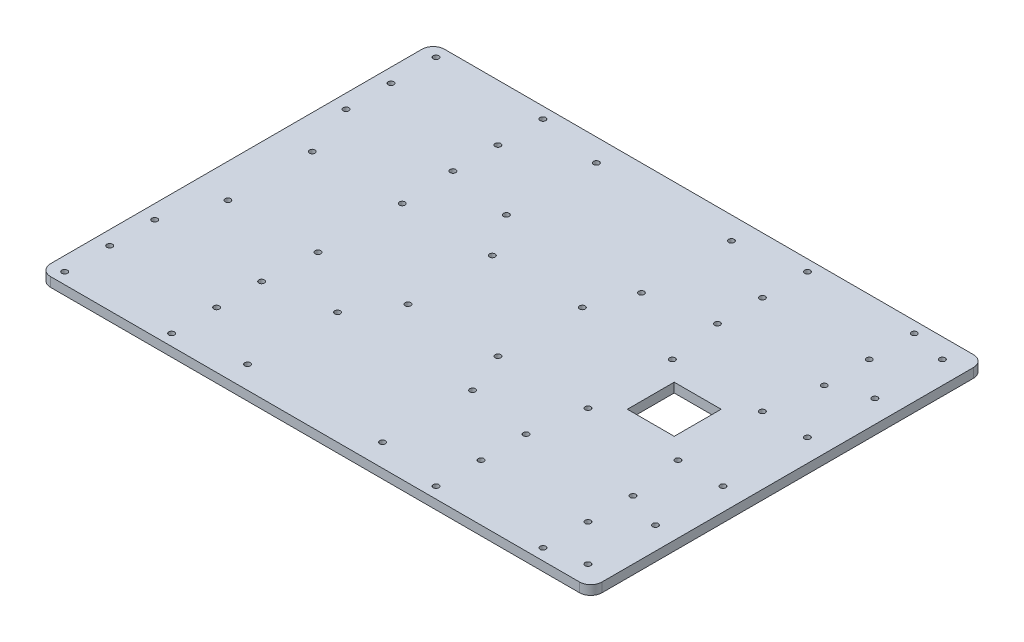
from build123d import *

# Parameters (mm, degrees)
SKETCH1_R           = 1.5
SKETCH1_W           = 25
SKETCH1_H           = 25
BOSS_EXTRUDE1_DEPTH = 5


with BuildPart() as part:
    # Sketch1 → Boss-Extrude1 (new body)
    with BuildSketch(Plane(origin=(0, 0, 0), x_dir=(1, 0, 0), z_dir=(0, 1, 0))):
        with BuildLine():
            Line((-129, -105), (129, -105))
            Line((129, -105), (153, -105))
            ThreePointArc((153, -105), (157.242640687, -103.242640687), (159, -99))
            Line((159, -99), (159, 99))
            ThreePointArc((159, 99), (157.242640687, 103.242640687), (153, 105))
            Line((153, 105), (129, 105))
            Line((129, 105), (-129, 105))
            ThreePointArc((-129, 105), (-133.242640687, 103.242640687), (-135, 99))
            Line((-135, 99), (-135, -99))
            ThreePointArc((-135, -99), (-133.242640687, -103.242640687), (-129, -105))
        make_face()
        with Locations((-127.5, 99)):
            Circle(SKETCH1_R, mode=Mode.SUBTRACT)
        with Locations((-127.5, 75)):
            Circle(SKETCH1_R, mode=Mode.SUBTRACT)
        with Locations((-127.5, 51)):
            Circle(SKETCH1_R, mode=Mode.SUBTRACT)
        with Locations((-70.5, 99)):
            Circle(SKETCH1_R, mode=Mode.SUBTRACT)
        with Locations((-70.5, 75)):
            Circle(SKETCH1_R, mode=Mode.SUBTRACT)
        with Locations((-70.5, 51)):
            Circle(SKETCH1_R, mode=Mode.SUBTRACT)
        with Locations((70.5, 51)):
            Circle(SKETCH1_R, mode=Mode.SUBTRACT)
        with Locations((70.5, 75)):
            Circle(SKETCH1_R, mode=Mode.SUBTRACT)
        with Locations((70.5, 99)):
            Circle(SKETCH1_R, mode=Mode.SUBTRACT)
        with Locations((127.5, 51)):
            Circle(SKETCH1_R, mode=Mode.SUBTRACT)
        with Locations((127.5, 75)):
            Circle(SKETCH1_R, mode=Mode.SUBTRACT)
        with Locations((127.5, 99)):
            Circle(SKETCH1_R, mode=Mode.SUBTRACT)
        with Locations((127.5, -99)):
            Circle(SKETCH1_R, mode=Mode.SUBTRACT)
        with Locations((127.5, -75)):
            Circle(SKETCH1_R, mode=Mode.SUBTRACT)
        with Locations((127.5, -51)):
            Circle(SKETCH1_R, mode=Mode.SUBTRACT)
        with Locations((70.5, -99)):
            Circle(SKETCH1_R, mode=Mode.SUBTRACT)
        with Locations((70.5, -75)):
            Circle(SKETCH1_R, mode=Mode.SUBTRACT)
        with Locations((70.5, -51)):
            Circle(SKETCH1_R, mode=Mode.SUBTRACT)
        with Locations((-70.5, -51)):
            Circle(SKETCH1_R, mode=Mode.SUBTRACT)
        with Locations((-70.5, -75)):
            Circle(SKETCH1_R, mode=Mode.SUBTRACT)
        with Locations((-70.5, -99)):
            Circle(SKETCH1_R, mode=Mode.SUBTRACT)
        with Locations((-127.5, -51)):
            Circle(SKETCH1_R, mode=Mode.SUBTRACT)
        with Locations((-127.5, -75)):
            Circle(SKETCH1_R, mode=Mode.SUBTRACT)
        with Locations((-127.5, -99)):
            Circle(SKETCH1_R, mode=Mode.SUBTRACT)
        with Locations((147, -94.5)):
            Circle(SKETCH1_R, mode=Mode.SUBTRACT)
        with Locations((147, -58.5)):
            Circle(SKETCH1_R, mode=Mode.SUBTRACT)
        with Locations((147, -22.5)):
            Circle(SKETCH1_R, mode=Mode.SUBTRACT)
        with Locations((123, -22.5)):
            Circle(SKETCH1_R, mode=Mode.SUBTRACT)
        with Locations((75, -22.5)):
            Circle(SKETCH1_R, mode=Mode.SUBTRACT)
        with Locations((27, -22.5)):
            Circle(SKETCH1_R, mode=Mode.SUBTRACT)
        with Locations((-21, -22.5)):
            Circle(SKETCH1_R, mode=Mode.SUBTRACT)
        with Locations((-69, -22.5)):
            Circle(SKETCH1_R, mode=Mode.SUBTRACT)
        with Locations((-117, -22.5)):
            Circle(SKETCH1_R, mode=Mode.SUBTRACT)
        with Locations((-36, -93)):
            Circle(SKETCH1_R, mode=Mode.SUBTRACT)
        with Locations((36, -93)):
            Circle(SKETCH1_R, mode=Mode.SUBTRACT)
        with Locations((36, -45)):
            Circle(SKETCH1_R, mode=Mode.SUBTRACT)
        with Locations((-36, -45)):
            Circle(SKETCH1_R, mode=Mode.SUBTRACT)
        with Locations((123, 22.5)):
            Circle(SKETCH1_R, mode=Mode.SUBTRACT)
        with Locations((75, 22.5)):
            Circle(SKETCH1_R, mode=Mode.SUBTRACT)
        with Locations((27, 22.5)):
            Circle(SKETCH1_R, mode=Mode.SUBTRACT)
        with Locations((-21, 22.5)):
            Circle(SKETCH1_R, mode=Mode.SUBTRACT)
        with Locations((-69, 22.5)):
            Circle(SKETCH1_R, mode=Mode.SUBTRACT)
        with Locations((-117, 22.5)):
            Circle(SKETCH1_R, mode=Mode.SUBTRACT)
        with Locations((36, 93)):
            Circle(SKETCH1_R, mode=Mode.SUBTRACT)
        with Locations((36, 45)):
            Circle(SKETCH1_R, mode=Mode.SUBTRACT)
        with Locations((-36, 45)):
            Circle(SKETCH1_R, mode=Mode.SUBTRACT)
        with Locations((-36, 93)):
            Circle(SKETCH1_R, mode=Mode.SUBTRACT)
        with Locations((147, 94.5)):
            Circle(SKETCH1_R, mode=Mode.SUBTRACT)
        with Locations((147, 58.5)):
            Circle(SKETCH1_R, mode=Mode.SUBTRACT)
        with Locations((147, 22.5)):
            Circle(SKETCH1_R, mode=Mode.SUBTRACT)
        with Locations((98.5, 0)):
            Rectangle(SKETCH1_W, SKETCH1_H, mode=Mode.SUBTRACT)
    extrude(amount=BOSS_EXTRUDE1_DEPTH)


solid = part.part
